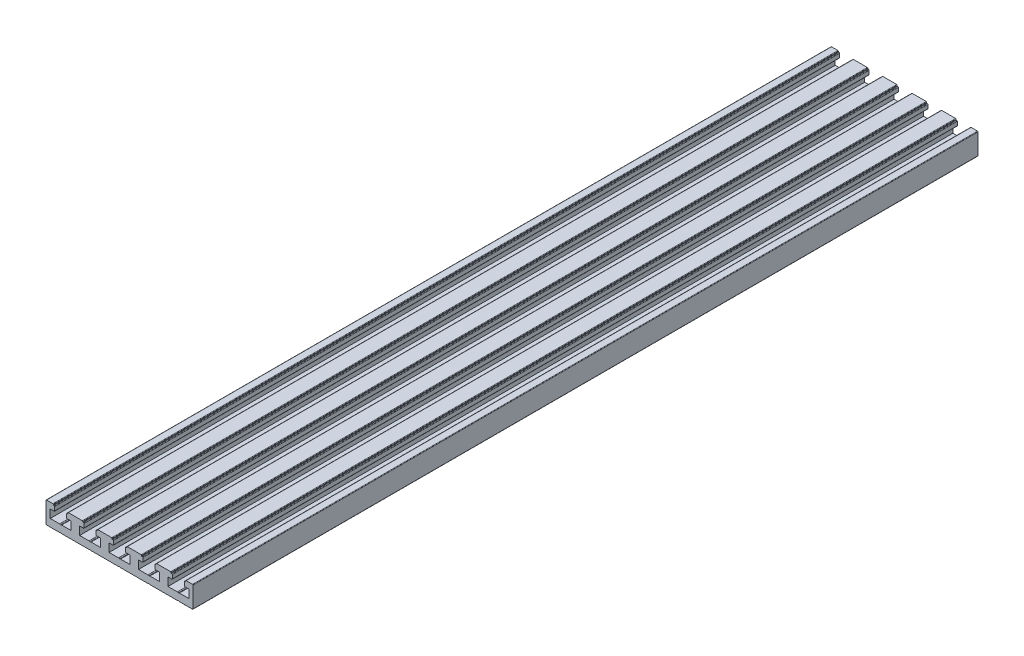
from build123d import *

# Parameters (mm, degrees)
BASE_DEPTH                                      = 400
CSK_FOR_M3_FLAT_HEAD_MACHINE_SCREW1_D           = 3.2
CSK_FOR_M3_FLAT_HEAD_MACHINE_SCREW1_CSINK_D     = 6
CSK_FOR_M3_FLAT_HEAD_MACHINE_SCREW1_CSINK_ANGLE = 90
M4X0_7_TAPPED_HOLE1_D                           = 3.3


with BuildPart() as part:
    # Sketch1 → Base (new body)
    with BuildSketch(Plane(origin=(0, 0, 0), x_dir=(-1, 0, 0), z_dir=(0, 0, -1))):
        with BuildLine():
            Line((-37.45, 8.85), (-37.45, -1.65))
            ThreePointArc((-37.45, -1.65), (-37.376776695, -1.826776695), (-37.2, -1.9))
            Line((-37.2, -1.9), (-30.543629459, -1.9))
            ThreePointArc((-30.543629459, -1.9), (-30.500649598, -1.896277753), (-30.458949592, -1.885221853))
            Line((-30.458949592, -1.885221853), (-30, -1.72))
            Line((-30, -1.72), (-29.541050408, -1.885221853))
            ThreePointArc((-29.541050408, -1.885221853), (-29.499350402, -1.896277753), (-29.456370541, -1.9))
            Line((-29.456370541, -1.9), (-15.543629459, -1.9))
            ThreePointArc((-15.543629459, -1.9), (-15.500649598, -1.896277753), (-15.458949592, -1.885221853))
            Line((-15.458949592, -1.885221853), (-15, -1.72))
            Line((-15, -1.72), (-14.541050408, -1.885221853))
            ThreePointArc((-14.541050408, -1.885221853), (-14.499350402, -1.896277753), (-14.456370541, -1.9))
            Line((-14.456370541, -1.9), (-0.543629459, -1.9))
            ThreePointArc((-0.543629459, -1.9), (-0.500649598, -1.896277753), (-0.458949592, -1.885221853))
            Line((-0.458949592, -1.885221853), (0, -1.72))
            Line((0, -1.72), (0.458949592, -1.885221853))
            ThreePointArc((0.458949592, -1.885221853), (0.500649598, -1.896277753), (0.543629459, -1.9))
            Line((0.543629459, -1.9), (14.456370541, -1.9))
            ThreePointArc((14.456370541, -1.9), (14.499350402, -1.896277753), (14.541050408, -1.885221853))
            Line((14.541050408, -1.885221853), (15, -1.72))
            Line((15, -1.72), (15.458949592, -1.885221853))
            ThreePointArc((15.458949592, -1.885221853), (15.500649598, -1.896277753), (15.543629459, -1.9))
            Line((15.543629459, -1.9), (29.456370541, -1.9))
            ThreePointArc((29.456370541, -1.9), (29.499350402, -1.896277753), (29.541050408, -1.885221853))
            Line((29.541050408, -1.885221853), (30, -1.72))
            Line((30, -1.72), (30.458949592, -1.885221853))
            ThreePointArc((30.458949592, -1.885221853), (30.500649598, -1.896277753), (30.543629459, -1.9))
            Line((30.543629459, -1.9), (37.2, -1.9))
            ThreePointArc((37.2, -1.9), (37.376776695, -1.826776695), (37.45, -1.65))
            Line((37.45, -1.65), (37.45, 8.85))
            ThreePointArc((37.45, 8.85), (37.376776695, 9.026776695), (37.2, 9.1))
            Line((37.2, 9.1), (33.95, 9.1))
            ThreePointArc((33.95, 9.1), (33.773223305, 9.026776695), (33.7, 8.85))
            Line((33.7, 8.85), (33.7, 8.5))
            Line((33.7, 8.5), (33.32, 8.5))
            ThreePointArc((33.32, 8.5), (33.143223305, 8.426776695), (33.07, 8.25))
            Line((33.07, 8.25), (33.07, 6.35))
            ThreePointArc((33.07, 6.35), (33.143223305, 6.173223305), (33.32, 6.1))
            Line((33.32, 6.1), (35.3, 6.1))
            Line((35.3, 6.1), (35.3, 1.9))
            Line((35.3, 1.9), (30.543629459, 1.9))
            ThreePointArc((30.543629459, 1.9), (30.500649598, 1.896277753), (30.458949592, 1.885221853))
            Line((30.458949592, 1.885221853), (30, 1.72))
            Line((30, 1.72), (29.541050408, 1.885221853))
            ThreePointArc((29.541050408, 1.885221853), (29.499350402, 1.896277753), (29.456370541, 1.9))
            Line((29.456370541, 1.9), (24.7, 1.9))
            Line((24.7, 1.9), (24.7, 6.1))
            Line((24.7, 6.1), (26.68, 6.1))
            ThreePointArc((26.68, 6.1), (26.856776695, 6.173223305), (26.93, 6.35))
            Line((26.93, 6.35), (26.93, 8.25))
            ThreePointArc((26.93, 8.25), (26.856776695, 8.426776695), (26.68, 8.5))
            Line((26.68, 8.5), (26.3, 8.5))
            Line((26.3, 8.5), (26.3, 8.85))
            ThreePointArc((26.3, 8.85), (26.226776695, 9.026776695), (26.05, 9.1))
            Line((26.05, 9.1), (18.95, 9.1))
            ThreePointArc((18.95, 9.1), (18.773223305, 9.026776695), (18.7, 8.85))
            Line((18.7, 8.85), (18.7, 8.5))
            Line((18.7, 8.5), (18.32, 8.5))
            ThreePointArc((18.32, 8.5), (18.143223305, 8.426776695), (18.07, 8.25))
            Line((18.07, 8.25), (18.07, 6.35))
            ThreePointArc((18.07, 6.35), (18.143223305, 6.173223305), (18.32, 6.1))
            Line((18.32, 6.1), (20.3, 6.1))
            Line((20.3, 6.1), (20.3, 1.9))
            Line((20.3, 1.9), (15.543629459, 1.9))
            ThreePointArc((15.543629459, 1.9), (15.500649598, 1.896277753), (15.458949592, 1.885221853))
            Line((15.458949592, 1.885221853), (15, 1.72))
            Line((15, 1.72), (14.541050408, 1.885221853))
            ThreePointArc((14.541050408, 1.885221853), (14.499350402, 1.896277753), (14.456370541, 1.9))
            Line((14.456370541, 1.9), (9.7, 1.9))
            Line((9.7, 1.9), (9.7, 6.1))
            Line((9.7, 6.1), (11.68, 6.1))
            ThreePointArc((11.68, 6.1), (11.856776695, 6.173223305), (11.93, 6.35))
            Line((11.93, 6.35), (11.93, 8.25))
            ThreePointArc((11.93, 8.25), (11.856776695, 8.426776695), (11.68, 8.5))
            Line((11.68, 8.5), (11.3, 8.5))
            Line((11.3, 8.5), (11.3, 8.85))
            ThreePointArc((11.3, 8.85), (11.226776695, 9.026776695), (11.05, 9.1))
            Line((11.05, 9.1), (3.95, 9.1))
            ThreePointArc((3.95, 9.1), (3.773223305, 9.026776695), (3.7, 8.85))
            Line((3.7, 8.85), (3.7, 8.5))
            Line((3.7, 8.5), (3.32, 8.5))
            ThreePointArc((3.32, 8.5), (3.143223305, 8.426776695), (3.07, 8.25))
            Line((3.07, 8.25), (3.07, 6.35))
            ThreePointArc((3.07, 6.35), (3.143223305, 6.173223305), (3.32, 6.1))
            Line((3.32, 6.1), (5.3, 6.1))
            Line((5.3, 6.1), (5.3, 1.9))
            Line((5.3, 1.9), (0.543629459, 1.9))
            ThreePointArc((0.543629459, 1.9), (0.500649598, 1.896277753), (0.458949592, 1.885221853))
            Line((0.458949592, 1.885221853), (0, 1.72))
            Line((0, 1.72), (-0.458949592, 1.885221853))
            ThreePointArc((-0.458949592, 1.885221853), (-0.500649598, 1.896277753), (-0.543629459, 1.9))
            Line((-0.543629459, 1.9), (-5.3, 1.9))
            Line((-5.3, 1.9), (-5.3, 6.1))
            Line((-5.3, 6.1), (-3.32, 6.1))
            ThreePointArc((-3.32, 6.1), (-3.143223305, 6.173223305), (-3.07, 6.35))
            Line((-3.07, 6.35), (-3.07, 8.25))
            ThreePointArc((-3.07, 8.25), (-3.143223305, 8.426776695), (-3.32, 8.5))
            Line((-3.32, 8.5), (-3.7, 8.5))
            Line((-3.7, 8.5), (-3.7, 8.85))
            ThreePointArc((-3.7, 8.85), (-3.773223305, 9.026776695), (-3.95, 9.1))
            Line((-3.95, 9.1), (-11.05, 9.1))
            ThreePointArc((-11.05, 9.1), (-11.226776695, 9.026776695), (-11.3, 8.85))
            Line((-11.3, 8.85), (-11.3, 8.5))
            Line((-11.3, 8.5), (-11.68, 8.5))
            ThreePointArc((-11.68, 8.5), (-11.856776695, 8.426776695), (-11.93, 8.25))
            Line((-11.93, 8.25), (-11.93, 6.35))
            ThreePointArc((-11.93, 6.35), (-11.856776695, 6.173223305), (-11.68, 6.1))
            Line((-11.68, 6.1), (-9.7, 6.1))
            Line((-9.7, 6.1), (-9.7, 1.9))
            Line((-9.7, 1.9), (-14.456370541, 1.9))
            ThreePointArc((-14.456370541, 1.9), (-14.499350402, 1.896277753), (-14.541050408, 1.885221853))
            Line((-14.541050408, 1.885221853), (-15, 1.72))
            Line((-15, 1.72), (-15.458949592, 1.885221853))
            ThreePointArc((-15.458949592, 1.885221853), (-15.500649598, 1.896277753), (-15.543629459, 1.9))
            Line((-15.543629459, 1.9), (-20.3, 1.9))
            Line((-20.3, 1.9), (-20.3, 6.1))
            Line((-20.3, 6.1), (-18.32, 6.1))
            ThreePointArc((-18.32, 6.1), (-18.143223305, 6.173223305), (-18.07, 6.35))
            Line((-18.07, 6.35), (-18.07, 8.25))
            ThreePointArc((-18.07, 8.25), (-18.143223305, 8.426776695), (-18.32, 8.5))
            Line((-18.32, 8.5), (-18.7, 8.5))
            Line((-18.7, 8.5), (-18.7, 8.85))
            ThreePointArc((-18.7, 8.85), (-18.773223305, 9.026776695), (-18.95, 9.1))
            Line((-18.95, 9.1), (-26.05, 9.1))
            ThreePointArc((-26.05, 9.1), (-26.226776695, 9.026776695), (-26.3, 8.85))
            Line((-26.3, 8.85), (-26.3, 8.5))
            Line((-26.3, 8.5), (-26.68, 8.5))
            ThreePointArc((-26.68, 8.5), (-26.856776695, 8.426776695), (-26.93, 8.25))
            Line((-26.93, 8.25), (-26.93, 6.35))
            ThreePointArc((-26.93, 6.35), (-26.856776695, 6.173223305), (-26.68, 6.1))
            Line((-26.68, 6.1), (-24.7, 6.1))
            Line((-24.7, 6.1), (-24.7, 1.9))
            Line((-24.7, 1.9), (-29.456370541, 1.9))
            ThreePointArc((-29.456370541, 1.9), (-29.499350402, 1.896277753), (-29.541050408, 1.885221853))
            Line((-29.541050408, 1.885221853), (-30, 1.72))
            Line((-30, 1.72), (-30.458949592, 1.885221853))
            ThreePointArc((-30.458949592, 1.885221853), (-30.500649598, 1.896277753), (-30.543629459, 1.9))
            Line((-30.543629459, 1.9), (-35.3, 1.9))
            Line((-35.3, 1.9), (-35.3, 6.1))
            Line((-35.3, 6.1), (-33.32, 6.1))
            ThreePointArc((-33.32, 6.1), (-33.143223305, 6.173223305), (-33.07, 6.35))
            Line((-33.07, 6.35), (-33.07, 8.25))
            ThreePointArc((-33.07, 8.25), (-33.143223305, 8.426776695), (-33.32, 8.5))
            Line((-33.32, 8.5), (-33.7, 8.5))
            Line((-33.7, 8.5), (-33.7, 8.85))
            ThreePointArc((-33.7, 8.85), (-33.773223305, 9.026776695), (-33.95, 9.1))
            Line((-33.95, 9.1), (-37.2, 9.1))
            ThreePointArc((-37.2, 9.1), (-37.376776695, 9.026776695), (-37.45, 8.85))
        make_face()
    extrude(amount=-BASE_DEPTH)

    # CSK for M3 Flat Head Machine Screw1 (through all)
    with Locations(Plane(origin=(-30, 1.9, 65), x_dir=(0, 0, 1), z_dir=(0, 1, 0))):
        with Locations((0, 0), (0, 60), (264.999950909, 60), (264.999950909, 0)):
            CounterSinkHole(CSK_FOR_M3_FLAT_HEAD_MACHINE_SCREW1_D / 2, CSK_FOR_M3_FLAT_HEAD_MACHINE_SCREW1_CSINK_D / 2, counter_sink_angle=CSK_FOR_M3_FLAT_HEAD_MACHINE_SCREW1_CSINK_ANGLE)

    # M4x0.7 Tapped Hole1 (through all)
    with Locations(Plane(origin=(0, 1.9, 0), x_dir=(1, 0, 0), z_dir=(0, 1, 0))):
        with Locations((15, -30), (15, -371)):
            Hole(M4X0_7_TAPPED_HOLE1_D / 2)


solid = part.part
